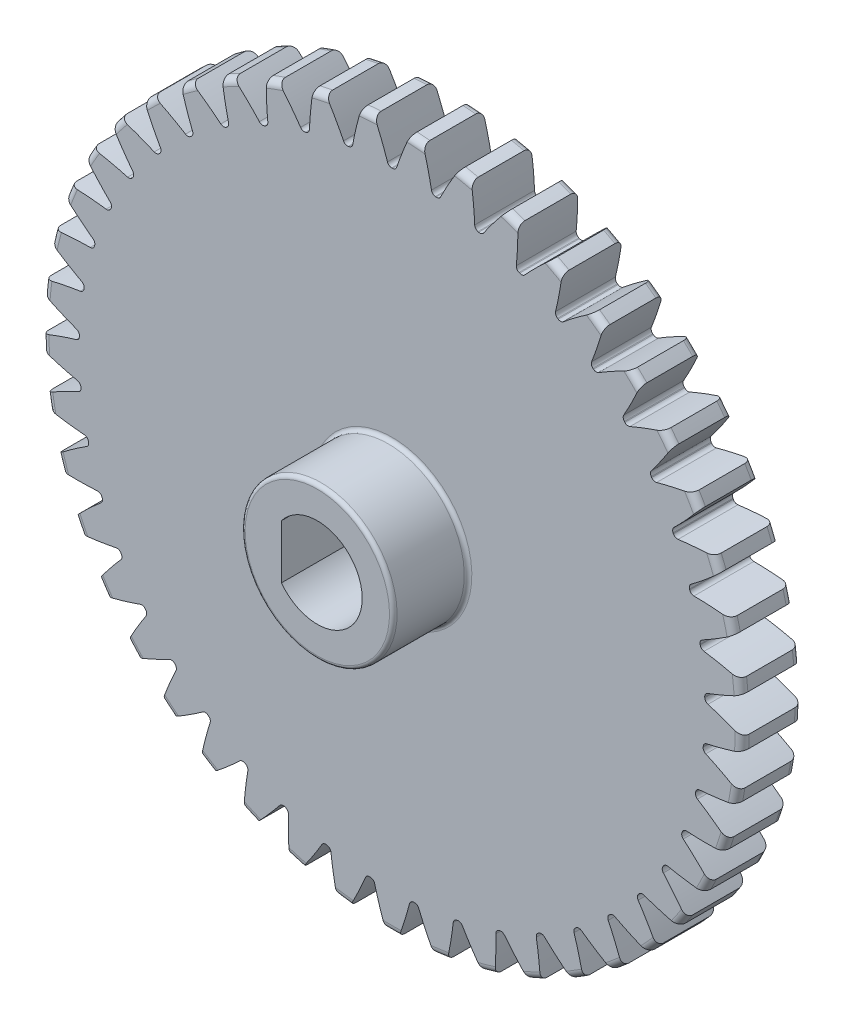
from build123d import *

# Parameters (mm, degrees)
FILLET2_R           = 0.468122
CUT_EXTRUDE2_DEPTH  = 34.476532687
CIRPATTERN1_COUNT   = 45
SKETCH8_R           = 8.802440398
BOSS_EXTRUDE1_DEPTH = 8.99922
SKETCH9_R           = 18.481030124
SKETCH9_R_2         = 5.08
CUT_EXTRUDE3_DEPTH  = 4.99872
FILLET3_R           = 0.254


with BuildPart() as part:
    # Sketch4 → Revolve1 (revolve)
    with BuildSketch(Plane(origin=(0, 0, 0), x_dir=(0, 0, -1), z_dir=(1, 0, 0))):
        Polygon((-8.99922, 6.35), (-8.99922, 11.684), (-4.0005, 11.684), (-4.0005, 23.4061), (0, 23.4061), (0, 6.35), align=None)
    revolve(axis=Axis((0, 0, 4.0005), (0, 0, 1)))

    # Fillet2
    fillet2_edges = [part.edges().sort_by_distance(p)[0] for p in [
        (0, -23.4061, 0),
        (0, -23.4061, 4.0005),
        (0, -11.684, 4.0005),
        (0, -11.684, 8.99922),
    ]]
    fillet(fillet2_edges, radius=FILLET2_R)

    # Sketch7 → Cut-Extrude2 (cut, through all)
    with BuildSketch(Plane.XY.offset(4.0005)):
        with BuildLine():
            ThreePointArc((-0.02533271, 20.915473547), (0, 20.915488889), (0.02533271, 20.915473547))
            ThreePointArc((0.02533271, 20.915473547), (0.200165137, 20.97167859), (0.309134625, 21.119499545))
            ThreePointArc((0.309134625, 21.119499545), (0.725319377, 22.259439517), (1.20258603, 23.375185647))
            ThreePointArc((1.20258603, 23.375185647), (0, 23.4061), (-1.20258603, 23.375185647))
            ThreePointArc((-1.20258603, 23.375185647), (-0.725319377, 22.259439517), (-0.309134625, 21.119499545))
            ThreePointArc((-0.309134625, 21.119499545), (-0.200165137, 20.97167859), (-0.02533271, 20.915473547))
        make_face()
    cut_extrude2 = extrude(amount=-CUT_EXTRUDE2_DEPTH, mode=Mode.SUBTRACT)

    # CirPattern1: Cut-Extrude2 ×45 about axis
    cirpattern1_axis = Axis((0, 0, 0), (0, 0, 1))
    for i in range(1, CIRPATTERN1_COUNT):
        add(cut_extrude2.rotate(cirpattern1_axis, i * 360 / CIRPATTERN1_COUNT), mode=Mode.SUBTRACT)

    # Sketch8 → Boss-Extrude1 (add)
    with BuildSketch(Plane.XY.offset(8.99922)):
        Circle(SKETCH8_R)
        with BuildLine():
            Line((-2.4, 1.8), (-2.4, -1.8))
            ThreePointArc((-2.4, -1.8), (3, 0), (-2.4, 1.8))
        make_face(mode=Mode.SUBTRACT)
    extrude(amount=-BOSS_EXTRUDE1_DEPTH)

    # Sketch9 → Cut-Extrude3 (cut)
    with BuildSketch(Plane.XY.offset(8.99922)):
        Circle(SKETCH9_R)
        Circle(SKETCH9_R_2, mode=Mode.SUBTRACT)
    extrude(amount=-CUT_EXTRUDE3_DEPTH, mode=Mode.SUBTRACT)

    # Fillet3
    fillet3_edges = [part.edges().sort_by_distance(p)[0] for p in [
        (-5.08, 0, 4.0005),
        (-5.08, 0, 8.99922),
    ]]
    fillet(fillet3_edges, radius=FILLET3_R)


solid = part.part
